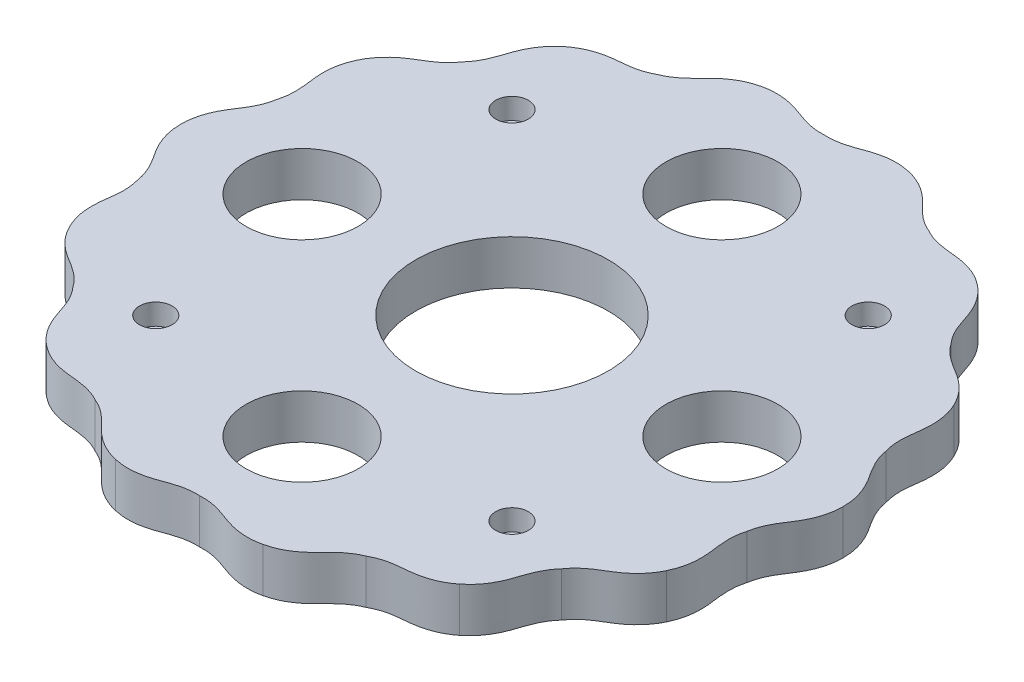
from build123d import *

# Parameters (mm, degrees)
BOSS_EXTRUDE3_DEPTH = 4.7625
SKETCH2_R           = 10.328125
SKETCH2_R_2         = 6
CUT_EXTRUDE1_DEPTH  = 4.7625
SKETCH2_4_R         = 1.75
CUT_EXTRUDE2_DEPTH  = 2.2467


with BuildPart() as part:
    # Sketch1 → Boss-Extrude3 (new body)
    with BuildSketch(Plane(origin=(0, 0, 0), x_dir=(1, 0, 0), z_dir=(0, 1, 0))):
        with BuildLine():
            Line((35.500002326, 0.003735881), (35.500002326, 0))
            Line((35.500002326, 0), (35.500002326, -0.003735881))
            add(Edge.make_bspline(
                [(32.644810899, -7.45096506), (32.674793712, -7.260710929), (32.757965618, -6.873262555), (32.975088878, -6.197475635), (33.30681421, -5.487322542), (33.693887271, -4.83935734), (34.139372051, -4.165162167), (34.499748971, -3.6014921), (34.870711868, -2.889611748), (35.149566879, -2.192738575), (35.418263863, -1.23361479), (35.50061524, -0.495919336), (35.500002326, -0.003735881)],
                knots=[0.02301065, 0.02301065, 0.02301065, 0.02301065, 0.053541567, 0.084072485, 0.145134319, 0.206196153, 0.267257988, 0.389381656, 0.511505325, 0.633628994, 0.755752663, 1, 1, 1, 1], degree=3))
            add(Edge.make_bspline(
                [(31.986017844, -15.399507835), (32.200120458, -14.956331799), (32.445998494, -14.255960238), (32.62005909, -13.275236314), (32.671181344, -12.526384626), (32.645828632, -11.724047822), (32.565707523, -11.059836954), (32.456861927, -10.25911949), (32.389262714, -9.507378309), (32.398512397, -8.723622254), (32.496104055, -8.020553026), (32.589276306, -7.635387164), (32.644810899, -7.45096506)],
                knots=[0.02301065, 0.02301065, 0.02301065, 0.02301065, 0.267257988, 0.389381656, 0.511505325, 0.633628994, 0.755752663, 0.816814497, 0.877876331, 0.938938166, 0.969469083, 1, 1, 1, 1], degree=3))
            Line((31.986017844, -15.399507835), (31.984396906, -15.402873748))
            Line((31.984396906, -15.402873748), (31.982775968, -15.406239661))
            add(Edge.make_bspline(
                [(26.179105738, -20.877140171), (26.288667493, -20.718736177), (26.531710341, -20.405744191), (27.020544594, -19.891087467), (27.62754267, -19.395191866), (28.257425012, -18.979340099), (28.951315253, -18.565199839), (29.520570914, -18.213712342), (30.163670245, -17.733285076), (30.717271866, -17.226414698), (31.375507699, -16.478857279), (31.769777787, -15.849947564), (31.982775968, -15.406239661)],
                knots=[0.02301065, 0.02301065, 0.02301065, 0.02301065, 0.053541567, 0.084072485, 0.145134319, 0.206196153, 0.267257988, 0.389381656, 0.511505325, 0.633628994, 0.755752663, 1, 1, 1, 1], degree=3))
            add(Edge.make_bspline(
                [(22.136810246, -27.752690162), (22.521996911, -27.446297993), (23.047405198, -26.921967502), (23.62974854, -26.113887841), (24.00072267, -25.461376898), (24.326001557, -24.727496287), (24.542005228, -24.094299727), (24.791357022, -23.325651886), (25.05662051, -22.619026286), (25.405013194, -21.916899767), (25.797990545, -21.325799714), (26.049053047, -21.019203188), (26.179105738, -20.877140171)],
                knots=[0.02301065, 0.02301065, 0.02301065, 0.02301065, 0.267257988, 0.389381656, 0.511505325, 0.633628994, 0.755752663, 0.816814497, 0.877876331, 0.938938166, 0.969469083, 1, 1, 1, 1], degree=3))
            Line((22.136810246, -27.752690162), (22.133889416, -27.755019446))
            Line((22.133889416, -27.755019446), (22.130968587, -27.75734873))
            add(Edge.make_bspline(
                [(14.52830762, -30.168341629), (14.695748267, -30.073161626), (15.05052444, -29.89661793), (15.714250068, -29.645025478), (16.476297475, -29.461605575), (17.224233175, -29.360231784), (18.029095404, -29.288171996), (18.694481743, -29.218483478), (19.482343797, -29.064663811), (20.201044438, -28.848188121), (21.118447439, -28.460259983), (21.746546212, -28.06469929), (22.130968587, -27.75734873)],
                knots=[0.02301065, 0.02301065, 0.02301065, 0.02301065, 0.053541567, 0.084072485, 0.145134319, 0.206196153, 0.267257988, 0.389381656, 0.511505325, 0.633628994, 0.755752663, 1, 1, 1, 1], degree=3))
            add(Edge.make_bspline(
                [(7.903135888, -34.609111839), (8.383115662, -34.500188263), (9.083990645, -34.255748926), (9.959276491, -33.780363616), (10.576626521, -33.353431213), (11.188111536, -32.833360849), (11.657457809, -32.356590942), (12.215619812, -31.772252855), (12.761207314, -31.250698702), (13.379739556, -30.769266488), (13.990268616, -30.407210225), (14.349495361, -30.239908237), (14.52830762, -30.168341629)],
                knots=[0.02301065, 0.02301065, 0.02301065, 0.02301065, 0.267257988, 0.389381656, 0.511505325, 0.633628994, 0.755752663, 0.816814497, 0.877876331, 0.938938166, 0.969469083, 1, 1, 1, 1], degree=3))
            Line((7.903135888, -34.609111839), (7.899493673, -34.60994315))
            Line((7.899493673, -34.60994315), (7.895851458, -34.610774462))
            add(Edge.make_bspline(
                [(0, -33.484333037), (0.192155866, -33.471228592), (0.588397592, -33.466099831), (1.295555593, -33.527402621), (2.061719496, -33.692786976), (2.779570716, -33.925969485), (3.535992098, -34.210262493), (4.165721189, -34.43617562), (4.942300224, -34.639429423), (5.683752409, -34.756224087), (6.678619663, -34.804759157), (7.416144457, -34.72089313), (7.895851458, -34.610774462)],
                knots=[0.02301065, 0.02301065, 0.02301065, 0.02301065, 0.053541567, 0.084072485, 0.145134319, 0.206196153, 0.267257988, 0.389381656, 0.511505325, 0.633628994, 0.755752663, 1, 1, 1, 1], degree=3))
            add(Edge.make_bspline(
                [(-7.895851458, -34.610774462), (-7.416144457, -34.72089313), (-6.678619663, -34.804759157), (-5.683752409, -34.756224087), (-4.942300224, -34.639429423), (-4.165721189, -34.43617562), (-3.535992098, -34.210262493), (-2.779570716, -33.925969485), (-2.061719496, -33.692786976), (-1.295555593, -33.527402621), (-0.588397592, -33.466099831), (-0.192155866, -33.471228592), (0, -33.484333037)],
                knots=[0.02301065, 0.02301065, 0.02301065, 0.02301065, 0.267257988, 0.389381656, 0.511505325, 0.633628994, 0.755752663, 0.816814497, 0.877876331, 0.938938166, 0.969469083, 1, 1, 1, 1], degree=3))
            Line((-7.895851458, -34.610774462), (-7.899493673, -34.60994315))
            Line((-7.899493673, -34.60994315), (-7.903135888, -34.609111839))
            add(Edge.make_bspline(
                [(-14.52830762, -30.168341629), (-14.349495361, -30.239908237), (-13.990268616, -30.407210225), (-13.379739556, -30.769266488), (-12.761207314, -31.250698702), (-12.215619812, -31.772252855), (-11.657457809, -32.356590942), (-11.188111536, -32.833360849), (-10.576626521, -33.353431213), (-9.959276491, -33.780363616), (-9.083990645, -34.255748926), (-8.383115662, -34.500188263), (-7.903135888, -34.609111839)],
                knots=[0.02301065, 0.02301065, 0.02301065, 0.02301065, 0.053541567, 0.084072485, 0.145134319, 0.206196153, 0.267257988, 0.389381656, 0.511505325, 0.633628994, 0.755752663, 1, 1, 1, 1], degree=3))
            add(Edge.make_bspline(
                [(-22.130968587, -27.75734873), (-21.746546212, -28.06469929), (-21.118447439, -28.460259983), (-20.201044438, -28.848188121), (-19.482343797, -29.064663811), (-18.694481743, -29.218483478), (-18.029095404, -29.288171996), (-17.224233175, -29.360231784), (-16.476297475, -29.461605575), (-15.714250068, -29.645025478), (-15.05052444, -29.89661793), (-14.695748267, -30.073161626), (-14.52830762, -30.168341629)],
                knots=[0.02301065, 0.02301065, 0.02301065, 0.02301065, 0.267257988, 0.389381656, 0.511505325, 0.633628994, 0.755752663, 0.816814497, 0.877876331, 0.938938166, 0.969469083, 1, 1, 1, 1], degree=3))
            Line((-22.130968587, -27.75734873), (-22.133889416, -27.755019446))
            Line((-22.133889416, -27.755019446), (-22.136810246, -27.752690162))
            add(Edge.make_bspline(
                [(-26.179105738, -20.877140171), (-26.049053047, -21.019203188), (-25.797990545, -21.325799714), (-25.405013194, -21.916899767), (-25.05662051, -22.619026286), (-24.791357022, -23.325651886), (-24.542005228, -24.094299727), (-24.326001557, -24.727496287), (-24.00072267, -25.461376898), (-23.62974854, -26.113887841), (-23.047405198, -26.921967502), (-22.521996911, -27.446297993), (-22.136810246, -27.752690162)],
                knots=[0.02301065, 0.02301065, 0.02301065, 0.02301065, 0.053541567, 0.084072485, 0.145134319, 0.206196153, 0.267257988, 0.389381656, 0.511505325, 0.633628994, 0.755752663, 1, 1, 1, 1], degree=3))
            add(Edge.make_bspline(
                [(-31.982775968, -15.406239661), (-31.769777787, -15.849947564), (-31.375507698, -16.478857279), (-30.717271866, -17.226414698), (-30.163670245, -17.733285076), (-29.520570914, -18.213712342), (-28.951315253, -18.565199839), (-28.257425012, -18.979340099), (-27.62754267, -19.395191866), (-27.020544594, -19.891087467), (-26.531710341, -20.405744191), (-26.288667493, -20.718736177), (-26.179105738, -20.877140171)],
                knots=[0.02301065, 0.02301065, 0.02301065, 0.02301065, 0.267257988, 0.389381656, 0.511505325, 0.633628994, 0.755752663, 0.816814497, 0.877876331, 0.938938166, 0.969469083, 1, 1, 1, 1], degree=3))
            Line((-31.982775968, -15.406239661), (-31.984396906, -15.402873748))
            Line((-31.984396906, -15.402873748), (-31.986017844, -15.399507835))
            add(Edge.make_bspline(
                [(-32.644810899, -7.45096506), (-32.589276306, -7.635387164), (-32.496104055, -8.020553026), (-32.398512397, -8.723622254), (-32.389262714, -9.507378309), (-32.456861927, -10.25911949), (-32.565707523, -11.059836954), (-32.645828632, -11.724047822), (-32.671181344, -12.526384626), (-32.62005909, -13.275236314), (-32.445998494, -14.255960238), (-32.200120458, -14.956331799), (-31.986017844, -15.399507835)],
                knots=[0.02301065, 0.02301065, 0.02301065, 0.02301065, 0.053541567, 0.084072485, 0.145134319, 0.206196153, 0.267257988, 0.389381656, 0.511505325, 0.633628994, 0.755752663, 1, 1, 1, 1], degree=3))
            add(Edge.make_bspline(
                [(-35.500002326, -0.003735881), (-35.50061524, -0.495919336), (-35.418263863, -1.23361479), (-35.149566879, -2.192738575), (-34.870711868, -2.889611748), (-34.499748971, -3.6014921), (-34.139372051, -4.165162167), (-33.693887271, -4.83935734), (-33.30681421, -5.487322542), (-32.975088878, -6.197475635), (-32.757965618, -6.873262555), (-32.674793712, -7.260710929), (-32.644810899, -7.45096506)],
                knots=[0.02301065, 0.02301065, 0.02301065, 0.02301065, 0.267257988, 0.389381656, 0.511505325, 0.633628994, 0.755752663, 0.816814497, 0.877876331, 0.938938166, 0.969469083, 1, 1, 1, 1], degree=3))
            Line((-35.500002326, -0.003735881), (-35.500002326, 0))
            Line((-35.500002326, 0), (-35.500002326, 0.003735881))
            add(Edge.make_bspline(
                [(-32.644810899, 7.45096506), (-32.674793712, 7.260710929), (-32.757965618, 6.873262555), (-32.975088878, 6.197475635), (-33.30681421, 5.487322542), (-33.693887271, 4.83935734), (-34.139372051, 4.165162167), (-34.499748971, 3.6014921), (-34.870711868, 2.889611748), (-35.149566879, 2.192738575), (-35.418263863, 1.23361479), (-35.50061524, 0.495919336), (-35.500002326, 0.003735881)],
                knots=[0.02301065, 0.02301065, 0.02301065, 0.02301065, 0.053541567, 0.084072485, 0.145134319, 0.206196153, 0.267257988, 0.389381656, 0.511505325, 0.633628994, 0.755752663, 1, 1, 1, 1], degree=3))
            add(Edge.make_bspline(
                [(-31.986017844, 15.399507835), (-32.200120458, 14.956331799), (-32.445998494, 14.255960238), (-32.62005909, 13.275236314), (-32.671181344, 12.526384626), (-32.645828632, 11.724047822), (-32.565707523, 11.059836954), (-32.456861927, 10.25911949), (-32.389262714, 9.507378309), (-32.398512397, 8.723622254), (-32.496104055, 8.020553026), (-32.589276306, 7.635387164), (-32.644810899, 7.45096506)],
                knots=[0.02301065, 0.02301065, 0.02301065, 0.02301065, 0.267257988, 0.389381656, 0.511505325, 0.633628994, 0.755752663, 0.816814497, 0.877876331, 0.938938166, 0.969469083, 1, 1, 1, 1], degree=3))
            Line((-31.986017844, 15.399507835), (-31.984396906, 15.402873748))
            Line((-31.984396906, 15.402873748), (-31.982775968, 15.406239661))
            add(Edge.make_bspline(
                [(-26.179105738, 20.877140171), (-26.288667493, 20.718736177), (-26.531710341, 20.405744191), (-27.020544594, 19.891087467), (-27.62754267, 19.395191866), (-28.257425012, 18.979340099), (-28.951315253, 18.565199839), (-29.520570914, 18.213712342), (-30.163670245, 17.733285076), (-30.717271866, 17.226414698), (-31.375507699, 16.478857278), (-31.769777787, 15.849947564), (-31.982775968, 15.406239661)],
                knots=[0.02301065, 0.02301065, 0.02301065, 0.02301065, 0.053541567, 0.084072485, 0.145134319, 0.206196153, 0.267257988, 0.389381656, 0.511505325, 0.633628994, 0.755752663, 1, 1, 1, 1], degree=3))
            add(Edge.make_bspline(
                [(-22.136810246, 27.752690162), (-22.521996911, 27.446297993), (-23.047405198, 26.921967502), (-23.62974854, 26.113887841), (-24.00072267, 25.461376898), (-24.326001557, 24.727496287), (-24.542005228, 24.094299727), (-24.791357022, 23.325651886), (-25.05662051, 22.619026286), (-25.405013194, 21.916899767), (-25.797990545, 21.325799714), (-26.049053047, 21.019203188), (-26.179105738, 20.877140171)],
                knots=[0.02301065, 0.02301065, 0.02301065, 0.02301065, 0.267257988, 0.389381656, 0.511505325, 0.633628994, 0.755752663, 0.816814497, 0.877876331, 0.938938166, 0.969469083, 1, 1, 1, 1], degree=3))
            Line((-22.136810246, 27.752690162), (-22.133889416, 27.755019446))
            Line((-22.133889416, 27.755019446), (-22.130968587, 27.75734873))
            add(Edge.make_bspline(
                [(-14.52830762, 30.168341629), (-14.695748267, 30.073161626), (-15.05052444, 29.89661793), (-15.714250068, 29.645025478), (-16.476297475, 29.461605575), (-17.224233175, 29.360231784), (-18.029095404, 29.288171996), (-18.694481743, 29.218483478), (-19.482343797, 29.064663811), (-20.201044438, 28.848188121), (-21.118447439, 28.460259983), (-21.746546212, 28.06469929), (-22.130968587, 27.75734873)],
                knots=[0.02301065, 0.02301065, 0.02301065, 0.02301065, 0.053541567, 0.084072485, 0.145134319, 0.206196153, 0.267257988, 0.389381656, 0.511505325, 0.633628994, 0.755752663, 1, 1, 1, 1], degree=3))
            add(Edge.make_bspline(
                [(-7.903135888, 34.609111839), (-8.383115662, 34.500188263), (-9.083990645, 34.255748926), (-9.959276491, 33.780363616), (-10.576626521, 33.353431213), (-11.188111536, 32.833360849), (-11.657457809, 32.356590942), (-12.215619812, 31.772252855), (-12.761207314, 31.250698702), (-13.379739556, 30.769266488), (-13.990268616, 30.407210225), (-14.349495361, 30.239908237), (-14.52830762, 30.168341629)],
                knots=[0.02301065, 0.02301065, 0.02301065, 0.02301065, 0.267257988, 0.389381656, 0.511505325, 0.633628994, 0.755752663, 0.816814497, 0.877876331, 0.938938166, 0.969469083, 1, 1, 1, 1], degree=3))
            Line((-7.903135888, 34.609111839), (-7.899493673, 34.60994315))
            Line((-7.899493673, 34.60994315), (-7.895851458, 34.610774462))
            add(Edge.make_bspline(
                [(0, 33.484333037), (-0.192155866, 33.471228592), (-0.588397592, 33.466099831), (-1.295555593, 33.527402621), (-2.061719496, 33.692786976), (-2.779570716, 33.925969485), (-3.535992098, 34.210262493), (-4.165721189, 34.43617562), (-4.942300224, 34.639429423), (-5.683752409, 34.756224087), (-6.678619663, 34.804759157), (-7.416144457, 34.72089313), (-7.895851458, 34.610774462)],
                knots=[0.02301065, 0.02301065, 0.02301065, 0.02301065, 0.053541567, 0.084072485, 0.145134319, 0.206196153, 0.267257988, 0.389381656, 0.511505325, 0.633628994, 0.755752663, 1, 1, 1, 1], degree=3))
            add(Edge.make_bspline(
                [(7.895851458, 34.610774462), (7.416144457, 34.72089313), (6.678619663, 34.804759157), (5.683752409, 34.756224087), (4.942300224, 34.639429423), (4.165721189, 34.43617562), (3.535992098, 34.210262493), (2.779570716, 33.925969485), (2.061719496, 33.692786976), (1.295555593, 33.527402621), (0.588397592, 33.466099831), (0.192155866, 33.471228592), (0, 33.484333037)],
                knots=[0.02301065, 0.02301065, 0.02301065, 0.02301065, 0.267257988, 0.389381656, 0.511505325, 0.633628994, 0.755752663, 0.816814497, 0.877876331, 0.938938166, 0.969469083, 1, 1, 1, 1], degree=3))
            Line((7.895851458, 34.610774462), (7.899493673, 34.60994315))
            Line((7.899493673, 34.60994315), (7.903135888, 34.609111839))
            add(Edge.make_bspline(
                [(14.52830762, 30.168341629), (14.349495361, 30.239908237), (13.990268616, 30.407210225), (13.379739556, 30.769266488), (12.761207314, 31.250698702), (12.215619812, 31.772252855), (11.657457809, 32.356590942), (11.188111536, 32.833360849), (10.576626521, 33.353431213), (9.959276491, 33.780363616), (9.083990645, 34.255748926), (8.383115662, 34.500188263), (7.903135888, 34.609111839)],
                knots=[0.02301065, 0.02301065, 0.02301065, 0.02301065, 0.053541567, 0.084072485, 0.145134319, 0.206196153, 0.267257988, 0.389381656, 0.511505325, 0.633628994, 0.755752663, 1, 1, 1, 1], degree=3))
            add(Edge.make_bspline(
                [(22.130968587, 27.75734873), (21.746546212, 28.06469929), (21.118447439, 28.460259983), (20.201044438, 28.848188121), (19.482343797, 29.064663811), (18.694481743, 29.218483478), (18.029095404, 29.288171996), (17.224233175, 29.360231784), (16.476297475, 29.461605575), (15.714250068, 29.645025478), (15.05052444, 29.89661793), (14.695748267, 30.073161626), (14.52830762, 30.168341629)],
                knots=[0.02301065, 0.02301065, 0.02301065, 0.02301065, 0.267257988, 0.389381656, 0.511505325, 0.633628994, 0.755752663, 0.816814497, 0.877876331, 0.938938166, 0.969469083, 1, 1, 1, 1], degree=3))
            Line((22.130968587, 27.75734873), (22.133889416, 27.755019446))
            Line((22.133889416, 27.755019446), (22.136810246, 27.752690162))
            add(Edge.make_bspline(
                [(26.179105738, 20.877140171), (26.049053047, 21.019203188), (25.797990545, 21.325799714), (25.405013194, 21.916899767), (25.05662051, 22.619026286), (24.791357022, 23.325651886), (24.542005228, 24.094299727), (24.326001557, 24.727496287), (24.00072267, 25.461376898), (23.62974854, 26.113887841), (23.047405198, 26.921967502), (22.521996911, 27.446297993), (22.136810246, 27.752690162)],
                knots=[0.02301065, 0.02301065, 0.02301065, 0.02301065, 0.053541567, 0.084072485, 0.145134319, 0.206196153, 0.267257988, 0.389381656, 0.511505325, 0.633628994, 0.755752663, 1, 1, 1, 1], degree=3))
            add(Edge.make_bspline(
                [(31.982775968, 15.406239661), (31.769777787, 15.849947564), (31.375507698, 16.478857279), (30.717271866, 17.226414698), (30.163670245, 17.733285076), (29.520570914, 18.213712342), (28.951315253, 18.565199839), (28.257425012, 18.979340099), (27.62754267, 19.395191866), (27.020544594, 19.891087467), (26.531710341, 20.405744191), (26.288667493, 20.718736177), (26.179105738, 20.877140171)],
                knots=[0.02301065, 0.02301065, 0.02301065, 0.02301065, 0.267257988, 0.389381656, 0.511505325, 0.633628994, 0.755752663, 0.816814497, 0.877876331, 0.938938166, 0.969469083, 1, 1, 1, 1], degree=3))
            Line((31.982775968, 15.406239661), (31.984396906, 15.402873748))
            Line((31.984396906, 15.402873748), (31.986017844, 15.399507835))
            add(Edge.make_bspline(
                [(32.644810899, 7.45096506), (32.589276306, 7.635387164), (32.496104055, 8.020553026), (32.398512397, 8.723622254), (32.389262714, 9.507378309), (32.456861927, 10.25911949), (32.565707523, 11.059836954), (32.645828632, 11.724047822), (32.671181344, 12.526384626), (32.62005909, 13.275236314), (32.445998494, 14.255960238), (32.200120458, 14.956331799), (31.986017844, 15.399507835)],
                knots=[0.02301065, 0.02301065, 0.02301065, 0.02301065, 0.053541567, 0.084072485, 0.145134319, 0.206196153, 0.267257988, 0.389381656, 0.511505325, 0.633628994, 0.755752663, 1, 1, 1, 1], degree=3))
            add(Edge.make_bspline(
                [(35.500002326, 0.003735881), (35.50061524, 0.495919336), (35.418263863, 1.23361479), (35.149566879, 2.192738575), (34.870711868, 2.889611748), (34.499748971, 3.6014921), (34.139372051, 4.165162167), (33.693887271, 4.83935734), (33.30681421, 5.487322542), (32.975088878, 6.197475635), (32.757965618, 6.873262555), (32.674793712, 7.260710929), (32.644810899, 7.45096506)],
                knots=[0.02301065, 0.02301065, 0.02301065, 0.02301065, 0.267257988, 0.389381656, 0.511505325, 0.633628994, 0.755752663, 0.816814497, 0.877876331, 0.938938166, 0.969469083, 1, 1, 1, 1], degree=3))
        make_face()
    extrude(amount=BOSS_EXTRUDE3_DEPTH)

    # Sketch2 → Cut-Extrude1 (cut)
    with BuildSketch(Plane(origin=(0, 4.7625, 0), x_dir=(1, 0, 0), z_dir=(0, 1, 0))):
        Circle(SKETCH2_R)
        with Locations((22.5, 0)):
            Circle(SKETCH2_R_2)
        with Locations((0, -22.5)):
            Circle(SKETCH2_R_2)
        with Locations((-22.5, 0)):
            Circle(SKETCH2_R_2)
        with Locations((0, 22.5)):
            Circle(SKETCH2_R_2)
    extrude(amount=-CUT_EXTRUDE1_DEPTH, mode=Mode.SUBTRACT)

    # Sketch2<4> → Cut-Extrude2 (cut)
    with BuildSketch(Plane(origin=(0, 4.7625, 0), x_dir=(1, 0, 0), z_dir=(0, 1, 0))):
        with Locations((19.091883092, 19.091883092)):
            Circle(SKETCH2_4_R)
        with Locations((19.091883092, -19.091883092)):
            Circle(SKETCH2_4_R)
        with Locations((-19.091883092, -19.091883092)):
            Circle(SKETCH2_4_R)
        with Locations((-19.091883092, 19.091883092)):
            Circle(SKETCH2_4_R)
    extrude(amount=-CUT_EXTRUDE2_DEPTH, mode=Mode.SUBTRACT)


solid = part.part
